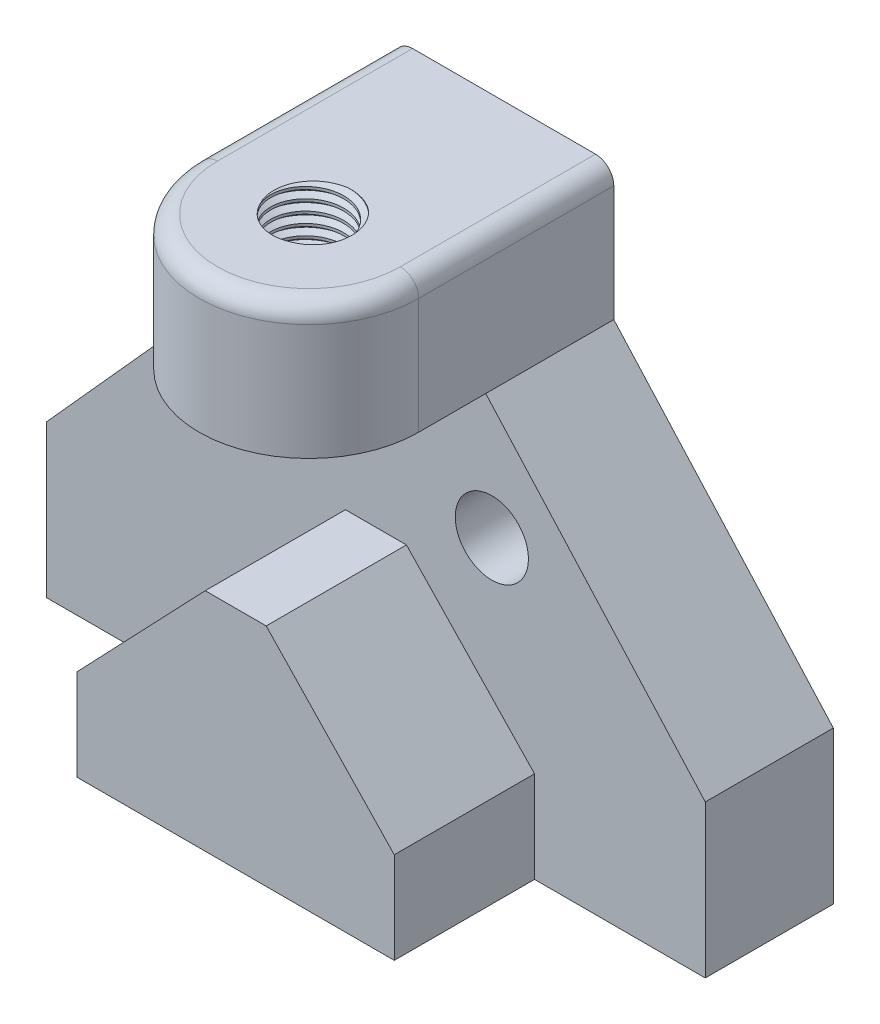
from build123d import *

# Parameters (mm, degrees)
EXTRUDE_1_DEPTH     = 21
EXTRUDE_2_DEPTH     = 23
EXTRUDE_3_DEPTH     = 22
CUT_EXTRUDE_1_REACH = 115.952
SKETCH_7_R          = 6
SKETCH_8_R          = 6
CUT_EXTRUDE_2_DEPTH = 107.423681575
THREAD_2_PITCH      = 1.75
FILLET_1_R          = 3
CHAMFER_1_SIZE      = 0.2


with BuildPart() as part:
    # 스케치3 → 보스-돌출1 (new body)
    with BuildSketch(Plane.XY):
        Polygon((54, 25), (18, 65), (-18, 65), (-54, 25), (-54, 0), (54, 0), align=None)
    extrude(amount=EXTRUDE_1_DEPTH)

    # 스케치4 → 보스-돌출2 (add)
    with BuildSketch(Plane.XY.offset(21)):
        Polygon((-26, 0), (26, 0), (26, 15), (5, 37), (-5, 37), (-26, 15), align=None)
    extrude(amount=EXTRUDE_2_DEPTH)

    # 스케치5 → 보스-돌출3 (add)
    with BuildSketch(Plane(origin=(0, 65, 0), x_dir=(1, 0, 0), z_dir=(0, 1, 0))):
        with BuildLine():
            Line((-18, 0), (18, 0))
            Line((18, 0), (18, -32))
            ThreePointArc((18, -32), (0, -50), (-18, -32))
            Line((-18, -32), (-18, 0))
        make_face()
    extrude(amount=EXTRUDE_3_DEPTH)

    # 스케치7 → 컷-돌출1 (cut, up to next)
    with BuildSketch(Plane(origin=(0, 87, 0), x_dir=(1, 0, 0), z_dir=(0, 1, 0)), mode=Mode.PRIVATE) as cut_extrude_1_sk1:
        with Locations(Location((0, -32, 0), (0, 0, 180))):
            Circle(SKETCH_7_R)
    cut_extrude_1_tool1 = extrude(cut_extrude_1_sk1.sketch, amount=-CUT_EXTRUDE_1_REACH, mode=Mode.PRIVATE) & part.part
    add(cut_extrude_1_tool1.solids().sort_by_distance((0, 87, 32))[0], mode=Mode.SUBTRACT)

    # 스케치8 → 컷-돌출2 (cut, through all)
    with BuildSketch(Plane.XY.offset(21)):
        with Locations((-19, 45)):
            Circle(SKETCH_8_R)
        with Locations((19, 45)):
            Circle(SKETCH_8_R)
    extrude(amount=-CUT_EXTRUDE_2_DEPTH, mode=Mode.SUBTRACT)

    # 나사산2: the profile of 나사산 프로파일2 profile screwed along a right-hand helix of 12.571429 turns, 10 arcs to a turn; built about Z, then put on its axis
    thread_2_z = Axis((0, 0, 0), (0, 0, 1))
    thread_2_corners = [(5.9997, 0, -0.000173205), (6.947215281, 0, 0.546874998), (6.947215281, 0, 0.765624998), (5.9997, 0, 1.3126732)]
    with BuildLine(mode=Mode.PRIVATE) as thread_2_profile:
        Line(thread_2_corners[0], thread_2_corners[1])
        Line(thread_2_corners[1], thread_2_corners[2])
        Line(thread_2_corners[2], thread_2_corners[3])
        Line(thread_2_corners[3], thread_2_corners[0])
    thread_2_cap = Face(thread_2_profile.wire())
    thread_2_turn_angles = [0, 18, 36, 54, 72, 90, 108, 126, 144, 162, 180, 198, 216, 234, 252, 270, 288, 306, 324, 342, 360]
    thread_2_turn_weights = [1, 0.9510565162951535, 1, 0.9510565162951535, 1, 0.9510565162951535, 1, 0.9510565162951535, 1, 0.9510565162951535, 1, 0.9510565162951535, 1, 0.9510565162951535, 1, 0.9510565162951535, 1, 0.9510565162951535, 1, 0.9510565162951535, 1]
    thread_2_turn_rails = [Edge.make_bspline([Vector(p[0], p[1], 0).rotate(thread_2_z, thread_2_turn_angles[k]) / thread_2_turn_weights[k] + Vector(0, 0, p[2] + THREAD_2_PITCH * thread_2_turn_angles[k] / 360) for k in range(21)], [0, 0, 0, 1, 1, 2, 2, 3, 3, 4, 4, 5, 5, 6, 6, 7, 7, 8, 8, 9, 9, 10, 10, 10], 2, thread_2_turn_weights) for p in thread_2_corners]
    thread_2_turn_sides = [Face.make_surface_from_curves(thread_2_turn_rails[p[0]], thread_2_turn_rails[p[1]]) for p in [(0, 1), (1, 2), (2, 3), (3, 0)]]
    thread_2_last_angles = [4320, 4338, 4356, 4374, 4392, 4410, 4428, 4446, 4464, 4482, 4500, 4512.857142857, 4525.714285714]
    thread_2_last_weights = [1, 0.9510565162951535, 1, 0.9510565162951535, 1, 0.9510565162951535, 1, 0.9510565162951535, 1, 0.9510565162951535, 1, 0.9749279121818262, 1]
    thread_2_last_rails = [Edge.make_bspline([Vector(p[0], p[1], 0).rotate(thread_2_z, thread_2_last_angles[k]) / thread_2_last_weights[k] + Vector(0, 0, p[2] + THREAD_2_PITCH * thread_2_last_angles[k] / 360) for k in range(13)], [0, 0, 0, 1, 1, 2, 2, 3, 3, 4, 4, 5, 5, 6, 6, 6], 2, thread_2_last_weights) for p in thread_2_corners]
    thread_2_last_sides = [Face.make_surface_from_curves(thread_2_last_rails[p[0]], thread_2_last_rails[p[1]]) for p in [(0, 1), (1, 2), (2, 3), (3, 0)]]
    thread_2 = Plane(origin=(0, 65, 32), x_dir=(1, 0, 0), z_dir=(0, 1, 0)) * Solid(Shell([*[p.moved(Location((0, 0, THREAD_2_PITCH * i))) for i in range(12) for p in thread_2_turn_sides], *thread_2_last_sides, thread_2_cap, thread_2_cap.rotate(thread_2_z, 4525.714285714).moved(Location((0, 0, THREAD_2_PITCH * 4525.714285714 / 360)))]))
    add(thread_2, mode=Mode.SUBTRACT)

    # 필렛1
    fillet_1_edges = [part.edges().sort_by_distance(p)[0] for p in [
        (-18, 87, 16),
        (0, 87, 50),
        (18, 87, 16),
    ]]
    fillet(fillet_1_edges, radius=FILLET_1_R)

    # 모따기1
    chamfer_1_edges = [part.edges().sort_by_distance(p)[0] for p in [
        (-25, 45, 0),
        (13, 45, 0),
    ]]
    chamfer(chamfer_1_edges, length=CHAMFER_1_SIZE)


solid = part.part
